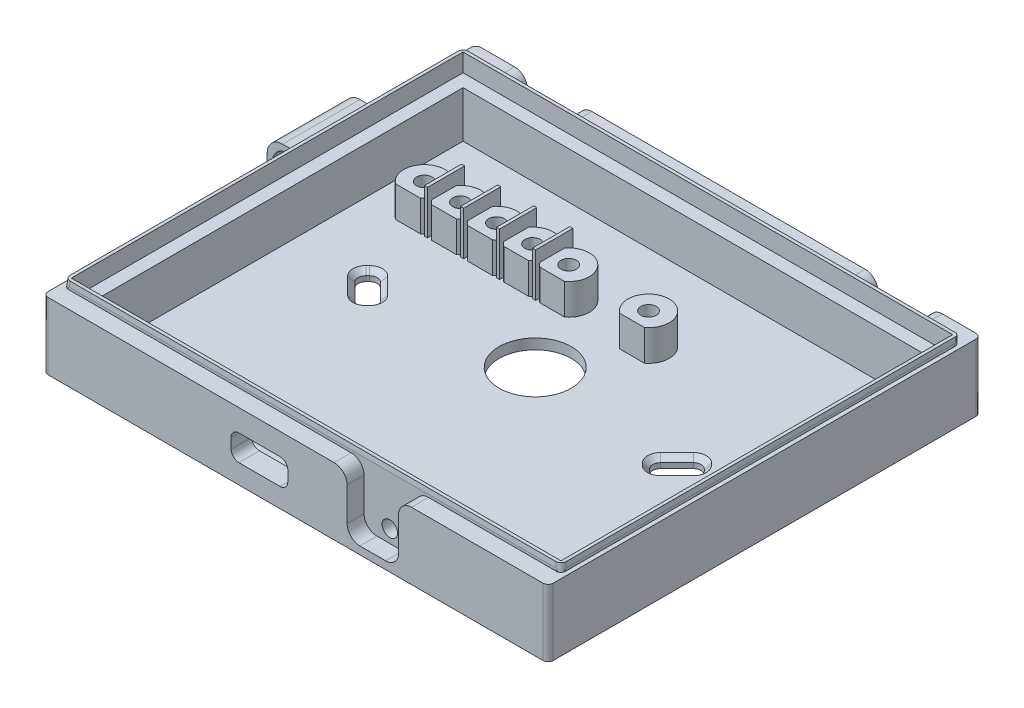
from build123d import *
from OCP.BRepFilletAPI import BRepFilletAPI_MakeChamfer

# Parameters (mm, degrees)
CROQUIS1_W                 = 98
CROQUIS1_H                 = 79
SALIENTE_EXTRUIR1_DEPTH    = 13
CROQUIS2_W                 = 95
CROQUIS2_H                 = 76
CORTAR_EXTRUIR1_DEPTH      = 11
SALIENTE_EXTRUIR2_DEPTH    = 9
CROQUIS4_R                 = 1.5
SALIENTE_EXTRUIR3_DEPTH    = 6
CROQUIS6_W                 = 0.6
CROQUIS6_H                 = 7.2
SALIENTE_EXTRUIR4_DEPTH    = 8.5
CROQUIS7_R                 = 7
CORTAR_EXTRUIR2_DEPTH      = 7.5
REDONDEO1_R                = 1.5
CHAFL_N1_SIZE              = 1
CROQUIS8_W                 = 96.4
CROQUIS8_H                 = 77.4
CROQUIS8_W_2               = 95
CROQUIS8_H_2               = 76
SALIENTE_EXTRUIR6_DEPTH    = 1.5
CHAFL_N2_SIZE              = 1
CHAFL_N2_SIZE2             = 0.087488664
SALIENTE_EXTRUIR8_START    = -13
CROQUIS15_W                = 98
CROQUIS15_H                = 2.5
SALIENTE_EXTRUIR8_DEPTH    = 13
REDONDEO2_R                = 1
CORTAR_EXTRUIR3_DEPTH      = 10
CORTAR_EXTRUIR3_DEPTH_BACK = 10
CROQUIS9_W                 = 11
CROQUIS9_H                 = 5
CROQUIS18_W                = 8
CROQUIS18_H                = 8
CROQUIS18_R                = 3
SALIENTE_EXTRUIR9_DEPTH    = 15
REDONDEO3_R                = 1.5
REDONDEO4_R                = 3
CORTAR_EXTRUIR4_DEPTH      = 3.3
CROQUIS12_R                = 1.5
CORTAR_EXTRUIR5_DEPTH      = 1
CORTAR_EXTRUIR6_DEPTH      = 3.3
CROQUIS14_R                = 1.5
CORTAR_EXTRUIR7_DEPTH      = 6
REDONDEO5_R                = 2.5


with BuildPart() as part:
    # Croquis1 → Saliente-Extruir1 (new body)
    with BuildSketch(Plane(origin=(0, 0, 0), x_dir=(1, 0, 0), z_dir=(0, 1, 0))):
        with Locations((49, 39.5)):
            Rectangle(CROQUIS1_W, CROQUIS1_H)
    extrude(amount=SALIENTE_EXTRUIR1_DEPTH)

    # Croquis2 → Cortar-Extruir1 (cut)
    with BuildSketch(Plane(origin=(0, 13, 0), x_dir=(1, 0, 0), z_dir=(0, 1, 0))):
        with Locations((49, 39.5)):
            Rectangle(CROQUIS2_W, CROQUIS2_H)
    extrude(amount=-CORTAR_EXTRUIR1_DEPTH, mode=Mode.SUBTRACT)

    # Croquis3 → Saliente-Extruir2 (add)
    with BuildSketch(Plane(origin=(0, 2, 0), x_dir=(1, 0, 0), z_dir=(0, 1, 0))):
        Polygon((24.5, 4), (24.5, 1.5), (1.5, 1.5), (1.5, 77.5), (96.5, 77.5), (96.5, 1.5), (58.5, 1.5), (58.5, 4), (94, 4), (94, 75), (4, 75), (4, 4), align=None)
    extrude(amount=SALIENTE_EXTRUIR2_DEPTH)

    # Croquis4 → Saliente-Extruir3 (add)
    # profile 1 of 2: a face of its own
    with BuildSketch(Plane(origin=(0, 2, 0), x_dir=(1, 0, 0), z_dir=(0, 1, 0))):
        with BuildLine():
            Line((10.6, 55.3), (15.4, 55.3))
            ThreePointArc((15.4, 55.3), (16.01688802, 55.873522001), (16.5, 56.563508327))
            ThreePointArc((16.5, 56.563508327), (16.98311198, 55.873522001), (17.6, 55.3))
            Line((17.6, 55.3), (22.4, 55.3))
            ThreePointArc((22.4, 55.3), (23.01688802, 55.873522001), (23.5, 56.563508327))
            ThreePointArc((23.5, 56.563508327), (23.98311198, 55.873522001), (24.6, 55.3))
            Line((24.6, 55.3), (29.4, 55.3))
            ThreePointArc((29.4, 55.3), (30.01688802, 55.873522001), (30.5, 56.563508327))
            ThreePointArc((30.5, 56.563508327), (30.98311198, 55.873522001), (31.6, 55.3))
            Line((31.6, 55.3), (36.4, 55.3))
            ThreePointArc((36.4, 55.3), (37.01688802, 55.873522001), (37.5, 56.563508327))
            ThreePointArc((37.5, 56.563508327), (37.98311198, 55.873522001), (38.6, 55.3))
            Line((38.6, 55.3), (43.4, 55.3))
            ThreePointArc((43.4, 55.3), (43.626477999, 61.51688802), (37.5, 60.436491673))
            ThreePointArc((37.5, 60.436491673), (34, 62.5), (30.5, 60.436491673))
            ThreePointArc((30.5, 60.436491673), (27, 62.5), (23.5, 60.436491673))
            ThreePointArc((23.5, 60.436491673), (20, 62.5), (16.5, 60.436491673))
            ThreePointArc((16.5, 60.436491673), (10.373522001, 61.51688802), (10.6, 55.3))
        make_face()
        with Locations(Location((13, 58.5, 0), (0, 0, 270))):
            Circle(CROQUIS4_R, mode=Mode.SUBTRACT)
        with Locations(Location((20, 58.5, 0), (0, 0, 270))):
            Circle(CROQUIS4_R, mode=Mode.SUBTRACT)
        with Locations(Location((27, 58.5, 0), (0, 0, 270))):
            Circle(CROQUIS4_R, mode=Mode.SUBTRACT)
        with Locations(Location((34, 58.5, 0), (0, 0, 270))):
            Circle(CROQUIS4_R, mode=Mode.SUBTRACT)
        with Locations(Location((41, 58.5, 0), (0, 0, 270))):
            Circle(CROQUIS4_R, mode=Mode.SUBTRACT)
    # profile 2 of 2: a face of its own
    with BuildSketch(Plane(origin=(0, 2, 0), x_dir=(1, 0, 0), z_dir=(0, 1, 0))):
        with BuildLine():
            Line((54.1, 55.3), (58.9, 55.3))
            ThreePointArc((58.9, 55.3), (56.5, 62.5), (54.1, 55.3))
        make_face()
        with Locations(Location((56.5, 58.5, 0), (0, 0, 270))):
            Circle(CROQUIS4_R, mode=Mode.SUBTRACT)
    extrude(amount=SALIENTE_EXTRUIR3_DEPTH)

    # Croquis6 → Saliente-Extruir4 (add)
    with BuildSketch(Plane(origin=(0, 2, 0), x_dir=(1, 0, 0), z_dir=(0, 1, 0))):
        with Locations((23.5, 58.9)):
            Rectangle(CROQUIS6_W, CROQUIS6_H)
        with Locations((16.5, 58.9)):
            Rectangle(CROQUIS6_W, CROQUIS6_H)
        with Locations((30.5, 58.9)):
            Rectangle(CROQUIS6_W, CROQUIS6_H)
        with Locations((37.5, 58.9)):
            Rectangle(CROQUIS6_W, CROQUIS6_H)
    extrude(amount=SALIENTE_EXTRUIR4_DEPTH)

    # Croquis7 → Cortar-Extruir2 (cut)
    with BuildSketch(Plane(origin=(0, 2, 0), x_dir=(1, 0, 0), z_dir=(0, 1, 0))):
        with Locations(Location((49, 44, 0), (0, 0, 270))):
            Circle(CROQUIS7_R)
        Polygon((15.110912703, 42.914213562), (20.414213562, 37.610912703), (22.889087297, 40.085786438), (17.585786438, 45.389087297), align=None)
        Polygon((75.110912703, 40.085786438), (80.414213562, 45.389087297), (82.889087297, 42.914213562), (77.585786438, 37.610912703), align=None)
    extrude(amount=-CORTAR_EXTRUIR2_DEPTH, mode=Mode.SUBTRACT)

    # Redondeo1
    redondeo1_edges = [part.edges().sort_by_distance(p)[0] for p in [
        (77.585786438, 1, -37.610912703),
        (75.110912703, 1, -40.085786438),
        (80.414213562, 1, -45.389087297),
        (82.889087297, 1, -42.914213562),
        (15.110912703, 1, -42.914213562),
        (17.585786438, 1, -45.389087297),
        (22.889087297, 1, -40.085786438),
        (20.414213562, 1, -37.610912703),
    ]]
    fillet(redondeo1_edges, radius=REDONDEO1_R)

    # Chaflán1
    chafl_n1_edges = [part.edges().sort_by_distance(p)[0] for p in [
        (17.762563133, 2, -40.262563133),
        (16.348349571, 2, -44.151650429),
        (20.237436867, 2, -42.737436867),
        (21.651650429, 2, -38.848349571),
        (77.762563133, 2, -42.737436867),
        (81.651650429, 2, -44.151650429),
        (80.237436867, 2, -40.262563133),
        (76.348349571, 2, -38.848349571),
        (15.732233047, 2, -42.914213562),
        (17.585786438, 2, -44.767766953),
        (22.267766953, 2, -40.085786438),
        (20.414213562, 2, -38.232233047),
        (80.414213562, 2, -44.767766953),
        (82.267766953, 2, -42.914213562),
        (75.732233047, 2, -40.085786438),
        (77.585786438, 2, -38.232233047),
    ]]
    chamfer(chafl_n1_edges, length=CHAFL_N1_SIZE)

    # Croquis8 → Saliente-Extruir6 (add)
    with BuildSketch(Plane(origin=(0, 13, 0), x_dir=(1, 0, 0), z_dir=(0, 1, 0))):
        with Locations((49, 39.5)):
            Rectangle(CROQUIS8_W, CROQUIS8_H)
        with Locations((49, 39.5)):
            Rectangle(CROQUIS8_W_2, CROQUIS8_H_2, mode=Mode.SUBTRACT)
    extrude(amount=SALIENTE_EXTRUIR6_DEPTH)

    # Chaflán2: one chamfer whose edges measure the first distance from different faces: ONE call of the kernel's chamfer builder (chamfer() names one face for all edges)
    chafl_n2_edges_1 = [part.edges().sort_by_distance(p)[0] for p in [
        (0.8, 14.5, -39.5),
    ]]
    chafl_n2_side_1 = [part.faces().sort_by_distance(p)[0] for p in [
        (0.8, 13.75, -39.5),
    ]]
    chafl_n2_edges_2 = [part.edges().sort_by_distance(p)[0] for p in [
        (49, 14.5, -0.8),
    ]]
    chafl_n2_side_2 = [part.faces().sort_by_distance(p)[0] for p in [
        (49, 13.75, -0.8),
    ]]
    chafl_n2_edges_3 = [part.edges().sort_by_distance(p)[0] for p in [
        (97.2, 14.5, -39.5),
    ]]
    chafl_n2_side_3 = [part.faces().sort_by_distance(p)[0] for p in [
        (97.2, 13.75, -39.5),
    ]]
    chafl_n2_edges_4 = [part.edges().sort_by_distance(p)[0] for p in [
        (49, 14.5, -78.2),
    ]]
    chafl_n2_side_4 = [part.faces().sort_by_distance(p)[0] for p in [
        (49, 13.75, -78.2),
    ]]
    chafl_n2 = BRepFilletAPI_MakeChamfer(part.part.solid().wrapped)
    for e in chafl_n2_edges_1:
        chafl_n2.Add(CHAFL_N2_SIZE, CHAFL_N2_SIZE2, e.wrapped, chafl_n2_side_1[0].wrapped)  # the first distance lies on this face
    for e in chafl_n2_edges_2:
        chafl_n2.Add(CHAFL_N2_SIZE, CHAFL_N2_SIZE2, e.wrapped, chafl_n2_side_2[0].wrapped)  # the first distance lies on this face
    for e in chafl_n2_edges_3:
        chafl_n2.Add(CHAFL_N2_SIZE, CHAFL_N2_SIZE2, e.wrapped, chafl_n2_side_3[0].wrapped)  # the first distance lies on this face
    for e in chafl_n2_edges_4:
        chafl_n2.Add(CHAFL_N2_SIZE, CHAFL_N2_SIZE2, e.wrapped, chafl_n2_side_4[0].wrapped)  # the first distance lies on this face
    add(Compound.cast(chafl_n2.Shape()), mode=Mode.REPLACE)

    # Croquis15 → Saliente-Extruir8 (add)
    with BuildSketch(Plane.XZ.offset(SALIENTE_EXTRUIR8_START)):
        with Locations((49, 1.25)):
            Rectangle(CROQUIS15_W, CROQUIS15_H)
        with Locations((49, -80.25)):
            Rectangle(CROQUIS15_W, CROQUIS15_H)
    extrude(amount=SALIENTE_EXTRUIR8_DEPTH)

    # Redondeo2
    # the kernel refuses this fillet: 1 mm, written as the material it takes off along each edge
    with BuildSketch(Plane(origin=(0.584576164, 11.037694287, -78.415423836), x_dir=(0.9962234400966145, -0.08649619246092892, -0.007567436278489077), z_dir=(0.08682659386424788, 0.9924325091389676, 0.086826593864241))) as redondeo2_piece_1_section:
        with BuildLine():
            CenterArc((REDONDEO2_R * 0.992432509139, -REDONDEO2_R), REDONDEO2_R, 90, 89.564769998)
            Line((-REDONDEO2_R * 0.00753863989878, -REDONDEO2_R * 0.992403876506), (0, 0))
            Line((0, 0), (REDONDEO2_R * 0.992432509139, 0))
        make_face()
    redondeo2_piece_1 = extrude(amount=5.96978774, mode=Mode.PRIVATE)
    redondeo2_piece_1 = split(redondeo2_piece_1, bisect_by=Plane(origin=(1.047224194, 13, -77.952775806), z_dir=(0, 1, 0)), keep=Keep.TOP, mode=Mode.PRIVATE)
    add(redondeo2_piece_1, mode=Mode.SUBTRACT)
    with BuildSketch(Plane(origin=(0.584576164, 11.037694287, -0.584576164), x_dir=(0.9962234400966146, -0.0864961924609289, 0.007567436278487959), z_dir=(0.08682659386424779, 0.9924325091389671, -0.0868265938642478))) as redondeo2_piece_2_section:
        with BuildLine():
            CenterArc((REDONDEO2_R * 0.992432509139, REDONDEO2_R), REDONDEO2_R, 180.435230002, 89.564769998)
            Line((-REDONDEO2_R * 0.00753863989878, REDONDEO2_R * 0.992403876506), (0, 0))
            Line((0, 0), (REDONDEO2_R * 0.992432509139, 0))
        make_face()
    redondeo2_piece_2 = extrude(amount=5.96978774, mode=Mode.PRIVATE)
    redondeo2_piece_2 = split(redondeo2_piece_2, bisect_by=Plane(origin=(1.047224194, 13, -1.047224194), z_dir=(0, 1, 0)), keep=Keep.TOP, mode=Mode.PRIVATE)
    add(redondeo2_piece_2, mode=Mode.SUBTRACT)
    with BuildSketch(Plane(origin=(97.415423836, 11.037694287, -0.584576164), x_dir=(0.007567436278489075, -0.08649619246092889, -0.9962234400966146), z_dir=(-0.086826593864241, 0.9924325091389676, -0.08682659386424786))) as redondeo2_piece_3_section:
        with BuildLine():
            CenterArc((REDONDEO2_R * 0.992432509139, REDONDEO2_R), REDONDEO2_R, 180.435230002, 89.564769998)
            Line((-REDONDEO2_R * 0.00753863989878, REDONDEO2_R * 0.992403876506), (0, 0))
            Line((0, 0), (REDONDEO2_R * 0.992432509139, 0))
        make_face()
    redondeo2_piece_3 = extrude(amount=5.96978774, mode=Mode.PRIVATE)
    redondeo2_piece_3 = split(redondeo2_piece_3, bisect_by=Plane(origin=(96.952775806, 13, -1.047224194), z_dir=(0, 1, 0)), keep=Keep.TOP, mode=Mode.PRIVATE)
    add(redondeo2_piece_3, mode=Mode.SUBTRACT)
    with BuildSketch(Plane(origin=(97.2, 13, -78.2), x_dir=(0, 0, 1), z_dir=(0, 1, 0))) as redondeo2_piece_4:
        with BuildLine():
            CenterArc((REDONDEO2_R, -REDONDEO2_R), REDONDEO2_R, 90, 90)
            Line((0, -REDONDEO2_R), (0, 0))
            Line((0, 0), (REDONDEO2_R, 0))
        make_face()
    extrude(amount=3, mode=Mode.SUBTRACT)
    with BuildSketch(Plane(origin=(0, 15.5, 2.5), x_dir=(0, 0, -1), z_dir=(0, -1, 0))) as redondeo2_piece_5:
        with BuildLine():
            CenterArc((REDONDEO2_R, REDONDEO2_R), REDONDEO2_R, 180, 90)
            Line((0, REDONDEO2_R), (0, 0))
            Line((0, 0), (REDONDEO2_R, 0))
        make_face()
    extrude(amount=18, mode=Mode.SUBTRACT)
    with BuildSketch(Plane(origin=(98, 15.5, 2.5), x_dir=(0, 0, -1), z_dir=(0, -1, 0)), Plane(origin=(98, 15.5, -81.5), x_dir=(-1, 0, 0), z_dir=(0, -1, 0)), Plane(origin=(0, 15.5, -81.5), x_dir=(0, 0, 1), z_dir=(0, -1, 0))) as redondeo2_piece_6:
        with BuildLine():
            CenterArc((REDONDEO2_R, -REDONDEO2_R), REDONDEO2_R, 90, 90)
            Line((0, -REDONDEO2_R), (0, 0))
            Line((0, 0), (REDONDEO2_R, 0))
        make_face()
    extrude(amount=18, mode=Mode.SUBTRACT)

    # Croquis9 → Cortar-Extruir3 (cut, two sides: drawn at the far end of the back side and taken through both)
    with BuildSketch(Plane.XY.offset(2.5).offset(-CORTAR_EXTRUIR3_DEPTH_BACK)):
        with Locations((42, 6.25)):
            Rectangle(CROQUIS9_W, CROQUIS9_H)
    extrude(amount=CORTAR_EXTRUIR3_DEPTH + CORTAR_EXTRUIR3_DEPTH_BACK, mode=Mode.SUBTRACT)

    # Croquis18 → Saliente-Extruir9 (add)
    with BuildSketch(Plane(origin=(0, 0, -64), x_dir=(-1, 0, 0), z_dir=(0, 0, -1))):
        with Locations((4, 6)):
            Rectangle(CROQUIS18_W, CROQUIS18_H)
        with Locations((4, 6)):
            Circle(CROQUIS18_R, mode=Mode.SUBTRACT)
    extrude(amount=-SALIENTE_EXTRUIR9_DEPTH)

    # Redondeo3
    redondeo3_edges = [part.edges().sort_by_distance(p)[0] for p in [
        (36.5, 8.75, 0.5),
        (36.5, 3.75, 0.5),
        (47.5, 3.75, 0.5),
        (47.5, 8.75, 0.5),
    ]]
    fillet(redondeo3_edges, radius=REDONDEO3_R)

    # Redondeo4
    redondeo4_edges = [part.edges().sort_by_distance(p)[0] for p in [
        (-8, 10, -56.5),
        (-8, 2, -56.5),
    ]]
    fillet(redondeo4_edges, radius=REDONDEO4_R)

    # Croquis11 → Cortar-Extruir4 (cut)
    with BuildSketch(Plane(origin=(0, 0, -81.5), x_dir=(-1, 0, 0), z_dir=(0, 0, -1))):
        with BuildLine():
            Line((-20, 13), (-20, 4))
            ThreePointArc((-20, 4), (-19.267766953, 2.232233047), (-17.5, 1.5))
            Line((-17.5, 1.5), (-12.5, 1.5))
            ThreePointArc((-12.5, 1.5), (-10.732233047, 2.232233047), (-10, 4))
            Line((-10, 4), (-10, 13))
            Line((-10, 13), (-10, 15))
            Line((-10, 15), (-20, 15))
            Line((-20, 15), (-20, 13))
        make_face()
        with BuildLine():
            Line((-80.5, 1.5), (-85.5, 1.5))
            ThreePointArc((-85.5, 1.5), (-87.267766953, 2.232233047), (-88, 4))
            Line((-88, 4), (-88, 13))
            Line((-88, 13), (-88, 15))
            Line((-88, 15), (-78, 15))
            Line((-78, 15), (-78, 13))
            Line((-78, 13), (-78, 4))
            ThreePointArc((-78, 4), (-78.732233047, 2.232233047), (-80.5, 1.5))
        make_face()
    extrude(amount=-CORTAR_EXTRUIR4_DEPTH, mode=Mode.SUBTRACT)

    # Croquis12 → Cortar-Extruir5 (cut)
    with BuildSketch(Plane(origin=(0, 0, -78.2), x_dir=(-1, 0, 0), z_dir=(0, 0, -1))):
        with Locations((-15, 4)):
            Circle(CROQUIS12_R)
        with Locations((-83, 4)):
            Circle(CROQUIS12_R)
    extrude(amount=-CORTAR_EXTRUIR5_DEPTH, mode=Mode.SUBTRACT)

    # Croquis13 → Cortar-Extruir6 (cut)
    with BuildSketch(Plane.XY.offset(2.5)):
        with BuildLine():
            Line((59, 13), (59, 4))
            ThreePointArc((59, 4), (59.732233047, 2.232233047), (61.5, 1.5))
            Line((61.5, 1.5), (66.5, 1.5))
            ThreePointArc((66.5, 1.5), (68.267766953, 2.232233047), (69, 4))
            Line((69, 4), (69, 13))
            Line((69, 13), (69, 15))
            Line((69, 15), (59, 15))
            Line((59, 15), (59, 13))
        make_face()
    extrude(amount=-CORTAR_EXTRUIR6_DEPTH, mode=Mode.SUBTRACT)

    # Croquis14 → Cortar-Extruir7 (cut)
    with BuildSketch(Plane.XY.offset(-0.8)):
        with Locations((64, 4)):
            Circle(CROQUIS14_R)
    extrude(amount=-CORTAR_EXTRUIR7_DEPTH, mode=Mode.SUBTRACT)

    # Redondeo5
    redondeo5_edges = [part.edges().sort_by_distance(p)[0] for p in [
        (10, 13, -79.85),
        (20, 13, -79.85),
        (88, 13, -79.85),
        (78, 13, -79.85),
        (69, 13, 0.85),
        (59, 13, 0.85),
    ]]
    fillet(redondeo5_edges, radius=REDONDEO5_R)


solid = part.part
